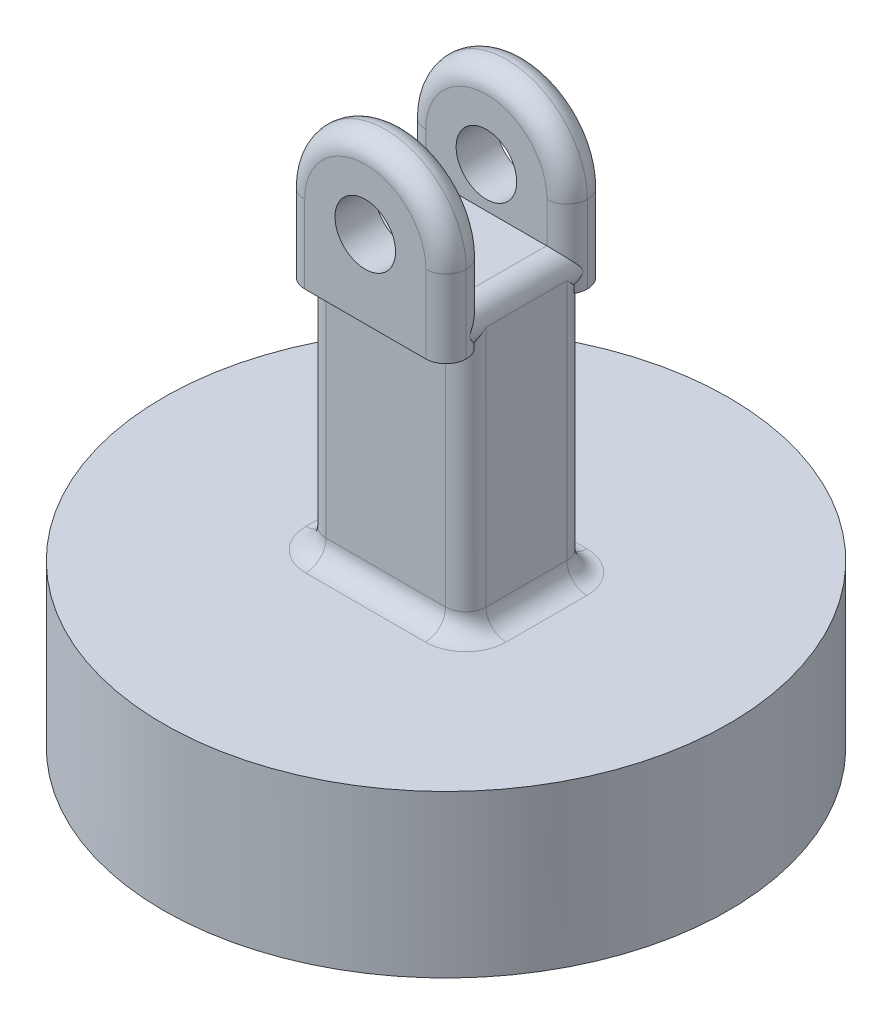
from build123d import *

# Parameters (mm, degrees)
SKETCH1_R           = 7
BOSS_EXTRUDE1_DEPTH = 10
SKETCH2_W           = 2
SKETCH2_H           = 1
BOSS_EXTRUDE2_DEPTH = 4
CUT_EXTRUDE2_DEPTH  = 10
FILLET1_R           = 1
FILLET2_R           = 0.5
CUT_EXTRUDE4_DEPTH  = 10
SKETCH5_W           = 3.959584723
SKETCH5_H           = 3
BOSS_EXTRUDE3_DEPTH = 7
FILLET3_R           = 0.5
FILLET4_R           = 0.5


# Some blends are built 0.0001 mm under size
with BuildPart() as part:
    # Sketch1 → Boss-Extrude1 (new body)
    with BuildSketch(Plane(origin=(0, 0, 0), x_dir=(1, 0, 0), z_dir=(0, 1, 0))):
        with Locations(Location((0, 0, 0), (0, 0, 270))):
            Circle(SKETCH1_R)
    extrude(amount=BOSS_EXTRUDE1_DEPTH)

    # Sketch2 → Boss-Extrude2 (add)
    with BuildSketch(Plane(origin=(0, 10, 0), x_dir=(1, 0, 0), z_dir=(0, 1, 0))):
        with Locations((-1, 1.5)):
            Rectangle(SKETCH2_W, SKETCH2_H)
        with Locations((1, 1.5)):
            Rectangle(SKETCH2_W, SKETCH2_H)
        with Locations((1, -1.5)):
            Rectangle(SKETCH2_W, SKETCH2_H)
        with Locations((-1, -1.5)):
            Rectangle(SKETCH2_W, SKETCH2_H)
    extrude(amount=BOSS_EXTRUDE2_DEPTH)

    # Sketch3 → Cut-Extrude2 (cut)
    with BuildSketch(Plane.XY.offset(2)):
        with BuildLine():
            Line((2, 14), (0, 14))
            ThreePointArc((0, 14), (1.414213562, 13.414213562), (2, 12))
            Line((2, 12), (2, 14))
        make_face()
        with BuildLine():
            Line((0, 14), (-2, 14))
            Line((-2, 14), (-1.414213562, 13.414213562))
            ThreePointArc((-1.414213562, 13.414213562), (-0.765366865, 13.847759065), (0, 14))
        make_face()
        with BuildLine():
            Line((-1.414213562, 13.414213562), (-2, 14))
            Line((-2, 14), (-2, 12))
            ThreePointArc((-2, 12), (-1.847759065, 12.765366865), (-1.414213562, 13.414213562))
        make_face()
        with BuildLine():
            ThreePointArc((0.75, 12), (0.287012574, 12.692909649), (-0.530330086, 12.530330086))
            Line((-0.530330086, 12.530330086), (0.530330086, 11.469669914))
            ThreePointArc((0.530330086, 11.469669914), (0.692909649, 11.712987426), (0.75, 12))
        make_face()
        with BuildLine():
            Line((0.530330086, 11.469669914), (-0.530330086, 12.530330086))
            ThreePointArc((-0.530330086, 12.530330086), (-0.530330086, 11.469669914), (0.530330086, 11.469669914))
        make_face()
    extrude(amount=-CUT_EXTRUDE2_DEPTH, mode=Mode.SUBTRACT)

    # Fillet1
    fillet1_edges = [part.edges().sort_by_distance(p)[0] for p in [
        (0, 10, -7),
    ]]
    fillet(fillet1_edges, radius=FILLET1_R)

    # Fillet2
    fillet2_edges = [part.edges().sort_by_distance(p)[0] for p in [
        (2, 11, 1),
        (-2, 11, 1),
        (2, 11, 2),
        (-2, 11, 2),
        (-2, 11, -2),
        (2, 11, -2),
        (-2, 11, -1),
        (2, 11, -1),
        (0, 14, 1),
        (0, 14, 2),
        (0, 14, -2),
        (0, 14, -1),
    ]]
    fillet(fillet2_edges, radius=FILLET2_R - 0.0001)  # a hair under: the kernel refuses the full size

    # Sketch4 → Cut-Extrude4 (cut, symmetric)
    with BuildSketch(Plane.XY):
        Polygon((-7, 4), (7, 4), (9.323554176, 4), (9.323554176, 10.076967931), (-7.870406088, 10.076967931), (-7.870406088, 4), align=None)
    extrude(amount=CUT_EXTRUDE4_DEPTH, both=True, mode=Mode.SUBTRACT)


with BuildPart() as cut_extrude4_piece_1:
    # of the separate pieces the step leaves, piece 1, a body of its own (cut_extrude4_pieces)
    add(part.part.solids().sort_by_distance((0, 0, 7))[0])



with BuildPart() as cut_extrude4_piece_2:
    # of the separate pieces the step leaves, piece 2, a body of its own (cut_extrude4_pieces)
    add(part.part.solids().sort_by_distance((-1.5001, 10.076967931, 2))[0])


with BuildPart() as cut_extrude4_piece_3:
    # of the separate pieces the step leaves, piece 3, a body of its own (cut_extrude4_pieces)
    add(part.part.solids().sort_by_distance((-2, 10.076967931, -1.5001))[0])


with BuildPart() as cut_extrude4_piece_1_1:
    add(cut_extrude4_piece_1.part)

    add(cut_extrude4_piece_2.part)  # Boss-Extrude3 merges Cut-Extrude4 piece 2

    add(cut_extrude4_piece_3.part)  # Boss-Extrude3 merges Cut-Extrude4 piece 3
    # Sketch5 → Boss-Extrude3 (add)
    with BuildSketch(Plane(origin=(0, 4, 0), x_dir=(1, 0, 0), z_dir=(0, 1, 0))):
        with Locations((0.009752672, 0)):
            Rectangle(SKETCH5_W, SKETCH5_H)
    extrude(amount=BOSS_EXTRUDE3_DEPTH)

    # Fillet3
    fillet3_edges = [cut_extrude4_piece_1_1.edges().sort_by_distance(p)[0] for p in [
        (-1.97003969, 11, 0),
        (1.989545033, 11, 0),
    ]]
    fillet(fillet3_edges, radius=FILLET3_R)

    # Fillet4
    # the kernel refuses this fillet: 0.5 mm, written as the material it takes off along each edge
    with BuildSketch(Plane(origin=(-1.97003969, 4, 1.5), x_dir=(0, 0, -1), z_dir=(0, 1, 0)), Plane(origin=(1.989545033, 4, 1.5), x_dir=(-1, 0, 0), z_dir=(0, 1, 0))) as fillet4_piece_1:
        with BuildLine():
            CenterArc((FILLET4_R, -FILLET4_R), FILLET4_R, 90, 90)
            Line((0, -FILLET4_R), (0, 0))
            Line((0, 0), (FILLET4_R, 0))
        make_face()
    extrude(amount=6.076967931, mode=Mode.SUBTRACT)
    with BuildSketch(Plane(origin=(-1.97003969, 4, 1.5), x_dir=(0, 0, -1), z_dir=(0, 1, 0))) as fillet4_piece_2_section:
        with BuildLine():
            CenterArc((FILLET4_R, -FILLET4_R), FILLET4_R, 90, 90)
            Line((0, -FILLET4_R), (0, 0))
            Line((0, 0), (FILLET4_R, 0))
        make_face()
    fillet4_piece_2 = extrude(amount=7.326967931, mode=Mode.PRIVATE)
    fillet4_piece_2 = fillet4_piece_2 - Plane(origin=(-1.47003969, 10.5, 1.201598319), x_dir=(-1, 0, 0), z_dir=(0, 0, -1)) * Cylinder(0.5, 17, mode=Mode.PRIVATE)
    fillet4_piece_2 = fillet4_piece_2 - Plane(origin=(-1.5001, 10.234965589, 1.4999), x_dir=(-1, 0, 0), z_dir=(0, -1, 0)) * Cylinder(0.4999, 17, mode=Mode.PRIVATE)
    add(fillet4_piece_2, mode=Mode.SUBTRACT)
    with BuildSketch(Plane(origin=(-1.97003969, 4, -1.5), x_dir=(0, 0, 1), z_dir=(0, 1, 0)), Plane(origin=(1.989545033, 4, -1.5), x_dir=(-1, 0, 0), z_dir=(0, 1, 0))) as fillet4_piece_3:
        with BuildLine():
            CenterArc((FILLET4_R, FILLET4_R), FILLET4_R, 180, 90)
            Line((0, FILLET4_R), (0, 0))
            Line((0, 0), (FILLET4_R, 0))
        make_face()
    extrude(amount=6.076967931, mode=Mode.SUBTRACT)
    with BuildSketch(Plane(origin=(-1.97003969, 4, -1.5), x_dir=(0, 0, 1), z_dir=(0, 1, 0))) as fillet4_piece_4_section:
        with BuildLine():
            CenterArc((FILLET4_R, FILLET4_R), FILLET4_R, 180, 90)
            Line((0, FILLET4_R), (0, 0))
            Line((0, 0), (FILLET4_R, 0))
        make_face()
    fillet4_piece_4 = extrude(amount=7.326967931, mode=Mode.PRIVATE)
    fillet4_piece_4 = fillet4_piece_4 - Plane(origin=(-1.5001, 10.234965589, -1.4999), x_dir=(-1, 0, 0), z_dir=(0, 1, 0)) * Cylinder(0.4999, 17, mode=Mode.PRIVATE)
    fillet4_piece_4 = fillet4_piece_4 - Plane(origin=(-1.47003969, 10.5, -1.201598319), x_dir=(-1, 0, 0), z_dir=(0, 0, -1)) * Cylinder(0.5, 17, mode=Mode.PRIVATE)
    add(fillet4_piece_4, mode=Mode.SUBTRACT)
    with BuildSketch(Plane(origin=(1.989545033, 4, -1.5), x_dir=(-1, 0, 0), z_dir=(0, 1, 0))) as fillet4_piece_5_section:
        with BuildLine():
            CenterArc((FILLET4_R, FILLET4_R), FILLET4_R, 180, 90)
            Line((0, FILLET4_R), (0, 0))
            Line((0, 0), (FILLET4_R, 0))
        make_face()
    fillet4_piece_5 = extrude(amount=7.326967931, mode=Mode.PRIVATE)
    fillet4_piece_5 = fillet4_piece_5 - Plane(origin=(1.489545033, 10.5, -1.228788283), x_dir=(1, 0, 0), z_dir=(0, 0, 1)) * Cylinder(0.5, 17, mode=Mode.PRIVATE)
    fillet4_piece_5 = fillet4_piece_5 - Plane(origin=(1.5001, 10.231594364, -1.4999), x_dir=(1, 0, 0), z_dir=(0, -1, 0)) * Cylinder(0.4999, 17, mode=Mode.PRIVATE)
    add(fillet4_piece_5, mode=Mode.SUBTRACT)
    with BuildSketch(Plane(origin=(1.989545033, 4, 1.5), x_dir=(-1, 0, 0), z_dir=(0, 1, 0))) as fillet4_piece_6_section:
        with BuildLine():
            CenterArc((FILLET4_R, -FILLET4_R), FILLET4_R, 90, 90)
            Line((0, -FILLET4_R), (0, 0))
            Line((0, 0), (FILLET4_R, 0))
        make_face()
    fillet4_piece_6 = extrude(amount=7.326967931, mode=Mode.PRIVATE)
    fillet4_piece_6 = fillet4_piece_6 - Plane(origin=(1.489545033, 10.5, 1.228788283), x_dir=(1, 0, 0), z_dir=(0, 0, 1)) * Cylinder(0.5, 17, mode=Mode.PRIVATE)
    fillet4_piece_6 = fillet4_piece_6 - Plane(origin=(1.5001, 10.231594364, 1.4999), x_dir=(1, 0, 0), z_dir=(0, 1, 0)) * Cylinder(0.4999, 17, mode=Mode.PRIVATE)
    add(fillet4_piece_6, mode=Mode.SUBTRACT)
    # the kernel refuses this fillet: 0.5 mm, written as the material it adds along each edge
    with BuildSketch(Plane(origin=(-1.97003969, 4, 1), x_dir=(0, 1, 0), z_dir=(0, 0, -1)), Plane(origin=(1.989545033, 4, -1), x_dir=(0, 1, 0), z_dir=(0, 0, 1))) as fillet4_2_piece_1:
        with BuildLine():
            CenterArc((FILLET4_R, -FILLET4_R), FILLET4_R, 90, 90)
            Line((0, -FILLET4_R), (0, 0))
            Line((0, 0), (FILLET4_R, 0))
        make_face()
    extrude(amount=2)
    with BuildSketch(Plane(origin=(-1.47003969, 4, -1.5), x_dir=(0, 0, -1), z_dir=(1, 0, 0))) as fillet4_2_piece_2:
        with BuildLine():
            CenterArc((FILLET4_R, FILLET4_R), FILLET4_R, 180, 90)
            Line((0, FILLET4_R), (0, 0))
            Line((0, 0), (FILLET4_R, 0))
        make_face()
    extrude(amount=2.959584723)
    with BuildSketch(Plane(origin=(1.489545033, 4, 1.5), x_dir=(0, 1, 0), z_dir=(-1, 0, 0))) as fillet4_2_piece_3:
        with BuildLine():
            CenterArc((FILLET4_R, -FILLET4_R), FILLET4_R, 90, 90)
            Line((0, -FILLET4_R), (0, 0))
            Line((0, 0), (FILLET4_R, 0))
        make_face()
    extrude(amount=2.959584723)
    with BuildSketch(Plane(origin=(1.489545033, 4, -1), x_dir=(0, 0, -1), z_dir=(-1, 0, 0))) as fillet4_2_piece_4:
        with BuildLine():
            CenterArc((0.5 + FILLET4_R, -FILLET4_R), FILLET4_R, 90, 90)
            Line((0.5 + FILLET4_R, 0), (0.5, 0))
            Line((0.5, 0), (0.5, -FILLET4_R))
        make_face()
    revolve(axis=Axis((1.489545033, 4, -1), (0, -1, 0)), revolution_arc=90)
    with BuildSketch(Plane(origin=(1.489545033, 4, 1), x_dir=(1, 0, 0), z_dir=(0, 0, -1))) as fillet4_2_piece_5:
        with BuildLine():
            CenterArc((0.5 + FILLET4_R, -FILLET4_R), FILLET4_R, 90, 90)
            Line((0.5 + FILLET4_R, 0), (0.5, 0))
            Line((0.5, 0), (0.5, -FILLET4_R))
        make_face()
    revolve(axis=Axis((1.489545033, 4, 1), (0, -1, 0)), revolution_arc=90)
    with BuildSketch(Plane(origin=(-1.47003969, 4, 1), x_dir=(-1, 0, 0), z_dir=(0, 0, -1))) as fillet4_2_piece_6:
        with BuildLine():
            CenterArc((0.5 + FILLET4_R, FILLET4_R), FILLET4_R, 180, 90)
            Line((0.5 + FILLET4_R, 0), (0.5, 0))
            Line((0.5, 0), (0.5, FILLET4_R))
        make_face()
    revolve(axis=Axis((-1.47003969, 4, 1), (0, 1, 0)), revolution_arc=90)
    with BuildSketch(Plane(origin=(-1.47003969, 4, -1), x_dir=(0, 0, -1), z_dir=(1, 0, 0))) as fillet4_2_piece_7:
        with BuildLine():
            CenterArc((0.5 + FILLET4_R, FILLET4_R), FILLET4_R, 180, 90)
            Line((0.5 + FILLET4_R, 0), (0.5, 0))
            Line((0.5, 0), (0.5, FILLET4_R))
        make_face()
    revolve(axis=Axis((-1.47003969, 4, -1), (0, 1, 0)), revolution_arc=90)


solid = cut_extrude4_piece_1_1.part
